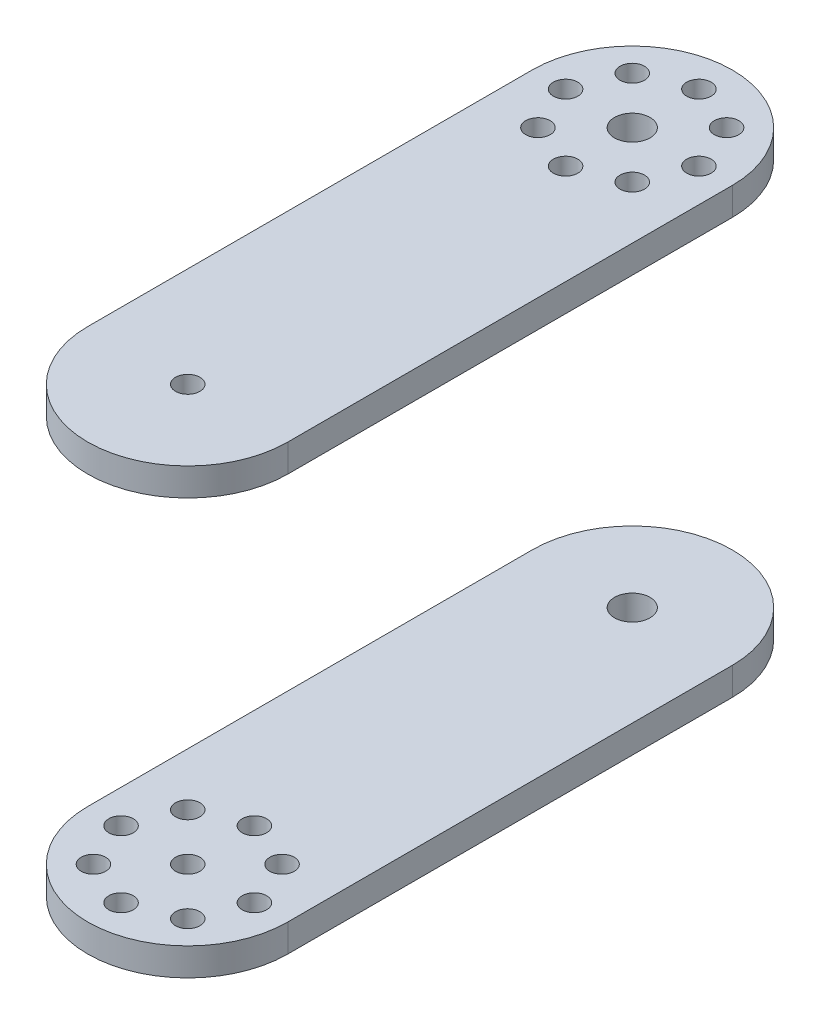
from build123d import *

# Parameters (mm, degrees)
SKETCH_1_R      = 1.1
SKETCH_1_R_2    = 1.6
EXTRUDE_1_DEPTH = 2.5
SKETCH_2_R      = 1.6
SKETCH_2_R_2    = 1.1
EXTRUDE_2_DEPTH = 2.5


with BuildPart() as part:
    # ｽｹｯﾁ1 → ﾎﾞｽ - 押し出し1 (new body)
    with BuildSketch(Plane(origin=(0, 0, 0), x_dir=(1, 0, 0), z_dir=(0, 1, 0))):
        with BuildLine():
            Line((-9, 40), (-9, 0))
            ThreePointArc((-9, 0), (0, -9), (9, 0))
            Line((9, 0), (9, 40))
            ThreePointArc((9, 40), (0, 49), (-9, 40))
        make_face()
        with Locations((0, 46)):
            Circle(SKETCH_1_R, mode=Mode.SUBTRACT)
        with Locations((4.242640687, 44.242640687)):
            Circle(SKETCH_1_R, mode=Mode.SUBTRACT)
        with Locations((6, 40)):
            Circle(SKETCH_1_R, mode=Mode.SUBTRACT)
        with Locations((4.242640687, 35.757359313)):
            Circle(SKETCH_1_R, mode=Mode.SUBTRACT)
        with Locations((0, 34)):
            Circle(SKETCH_1_R, mode=Mode.SUBTRACT)
        with Locations((-4.242640687, 35.757359313)):
            Circle(SKETCH_1_R, mode=Mode.SUBTRACT)
        with Locations((-6, 40)):
            Circle(SKETCH_1_R, mode=Mode.SUBTRACT)
        with Locations((-4.242640687, 44.242640687)):
            Circle(SKETCH_1_R, mode=Mode.SUBTRACT)
        with Locations((0, 40)):
            Circle(SKETCH_1_R_2, mode=Mode.SUBTRACT)
        Circle(SKETCH_1_R, mode=Mode.SUBTRACT)
    extrude(amount=EXTRUDE_1_DEPTH)


with BuildPart() as body_2:
    # ｽｹｯﾁ2 → ﾎﾞｽ - 押し出し2 (new body)
    with BuildSketch(Plane(origin=(0, -34.9, 0), x_dir=(1, 0, 0), z_dir=(0, 1, 0))):
        with BuildLine():
            Line((9, 0), (9, 40))
            ThreePointArc((9, 40), (0, 49), (-9, 40))
            Line((-9, 40), (-9, 0))
            ThreePointArc((-9, 0), (0, -9), (9, 0))
        make_face()
        with Locations((0, 40)):
            Circle(SKETCH_2_R, mode=Mode.SUBTRACT)
        Circle(SKETCH_2_R_2, mode=Mode.SUBTRACT)
        with Locations((0, 6)):
            Circle(SKETCH_2_R_2, mode=Mode.SUBTRACT)
        with Locations((4.242640687, 4.242640687)):
            Circle(SKETCH_2_R_2, mode=Mode.SUBTRACT)
        with Locations((6, 0)):
            Circle(SKETCH_2_R_2, mode=Mode.SUBTRACT)
        with Locations((4.242640687, -4.242640687)):
            Circle(SKETCH_2_R_2, mode=Mode.SUBTRACT)
        with Locations((0, -6)):
            Circle(SKETCH_2_R_2, mode=Mode.SUBTRACT)
        with Locations((-4.242640687, -4.242640687)):
            Circle(SKETCH_2_R_2, mode=Mode.SUBTRACT)
        with Locations((-6, 0)):
            Circle(SKETCH_2_R_2, mode=Mode.SUBTRACT)
        with Locations((-4.242640687, 4.242640687)):
            Circle(SKETCH_2_R_2, mode=Mode.SUBTRACT)
    extrude(amount=-EXTRUDE_2_DEPTH)


solid = Compound([part.part, body_2.part])
